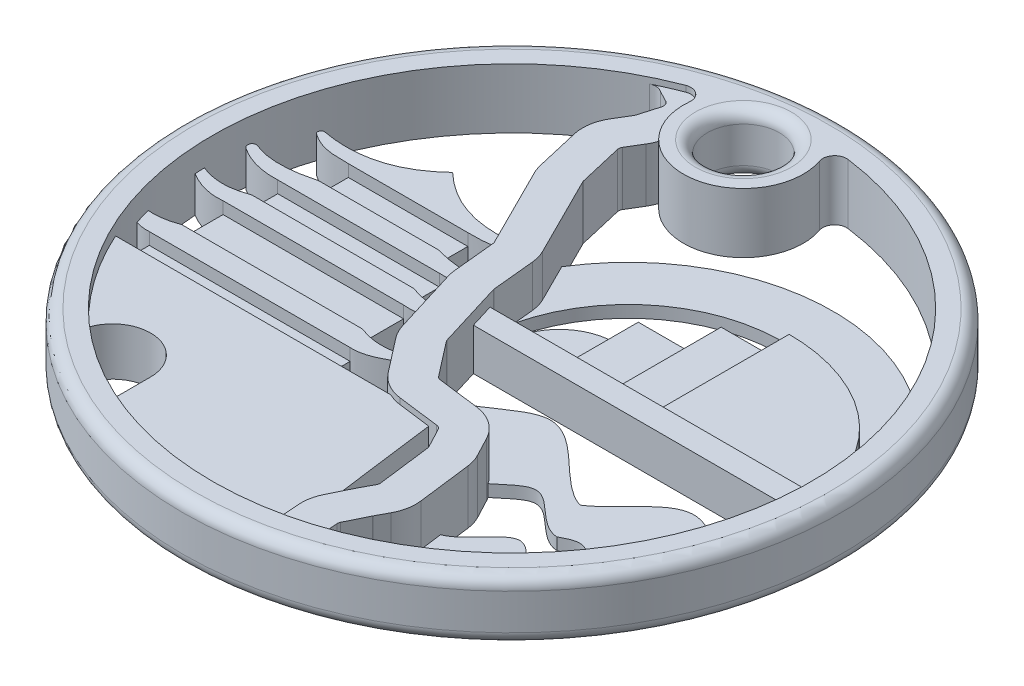
from build123d import *

# Parameters (mm, degrees)
SKETCH_2_R               = 27.5
SKETCH_2_R_2             = 25
EXTRUDE_1_DEPTH          = 5
EXTRUDE_2_DEPTH          = 4.5
SKETCH_4_R               = 0.273006505
SKETCH_4_R_2             = 0.365952535
SKETCH_4_R_3             = 0.304637926
SKETCH_4_R_4             = 0.289312323
EXTRUDE_2_2_DEPTH        = 3
SKETCH_4_3_W             = 9.97198698
SKETCH_4_3_H             = 2.474276502
SKETCH_4_3_W_2           = 13.509129154
SKETCH_4_3_H_2           = 2.168275674
SKETCH_4_3_W_3           = 15.060350668
SKETCH_4_3_H_3           = 3.449581981
SKETCH_4_3_W_4           = 16.758005346
SKETCH_4_3_H_4           = 2.720759466
EXTRUDE_3_DEPTH          = 2
EXTRUDE_4_DEPTH          = 4
EXTRUDE_5_DEPTH          = 1.5
SKETCH_8_3_W             = 4.317570968
SKETCH_8_3_H             = 1.958884726
EXTRUDE_6_DEPTH          = 2
EXTRUDE_7_DEPTH          = 2.5
EXTRUDE_8_DEPTH          = 3
SKETCH_8_6_W             = 28.985093105
SKETCH_8_6_H             = 2
EXTRUDE_9_DEPTH          = 3.5
CUT_EXTRUDE_1_DEPTH      = 49.528775397
CUT_EXTRUDE_1_DEPTH_BACK = 49.528775397
SKETCH_5_OUTSIDE_W       = 82.454
SKETCH_5_OUTSIDE_H       = 79.67
SKETCH_5_OUTSIDE_R       = 27.5
EXTRUDE_10_DEPTH         = 1
EXTRUDE_11_DEPTH         = 1
SKETCH_11_R              = 5
SKETCH_11_R_2            = 3
EXTRUDE_12_DEPTH         = 5
FILLET_1_DEPTH           = 4.5
FILLET_2_R               = 1


with BuildPart() as part:
    # 草图2 → 凸台-拉伸1 (new body)
    with BuildSketch(Plane(origin=(0, 0, 0), x_dir=(1, 0, 0), z_dir=(0, 1, 0))):
        with Locations(Location((0, 0, 0), (0, 0, 270))):
            Circle(SKETCH_2_R)
        with Locations(Location((0, 0, 0), (0, 0, 270))):
            Circle(SKETCH_2_R_2, mode=Mode.SUBTRACT)
    extrude(amount=EXTRUDE_1_DEPTH)


with BuildPart() as body_2:
    # 草图3 → Extrude 2 (new body)
    with BuildSketch(Plane(origin=(0, 0, 0), x_dir=(1, 0, 0), z_dir=(0, 1, 0))):
        with BuildLine():
            Line((80.84631891, -22.515953749), (80.683372147, -20.299877764))
            ThreePointArc((80.683372147, -20.299877764), (80.691175945, -20.167995114), (80.733248796, -20.042760103))
            Line((80.733248796, -20.042760103), (81.612869677, -18.252103309))
            ThreePointArc((81.612869677, -18.252103309), (81.617063019, -18.243764459), (81.62141129, -18.235505338))
            Line((81.62141129, -18.235505338), (82.151932536, -17.250251596))
            ThreePointArc((82.151932536, -17.250251596), (82.510986399, -16.23243541), (82.542859076, -15.153614944))
            Line((82.542859076, -15.153614944), (81.979043484, -10.676255825))
            ThreePointArc((81.979043484, -10.676255825), (81.84413837, -10.05999807), (81.600800384, -9.477967457))
            Line((81.600800384, -9.477967457), (80.755478673, -7.878710166))
            ThreePointArc((80.755478673, -7.878710166), (79.655606893, -6.638155198), (78.108211623, -6.042955705))
            Line((78.108211623, -6.042955705), (74.603802363, -5.59163027))
            ThreePointArc((74.603802363, -5.59163027), (74.419212891, -5.529626474), (74.272306972, -5.401812566))
            Line((74.272306972, -5.401812566), (72.082378064, -2.573154393))
            ThreePointArc((72.082378064, -2.573154393), (72.033823865, -2.49715156), (71.999712814, -2.413662775))
            Line((71.999712814, -2.413662775), (70.300005336, 3.128861611))
            ThreePointArc((70.300005336, 3.128861611), (70.287813759, 3.177040914), (70.280465308, 3.226192517))
            Line((70.280465308, 3.226192517), (69.930990599, 6.755887073))
            ThreePointArc((69.930990599, 6.755887073), (69.810582734, 7.382211251), (69.578515841, 7.97628615))
            Line((69.578515841, 7.97628615), (66.24020302, 14.652911792))
            ThreePointArc((66.24020302, 14.652911792), (66.217076585, 14.706871146), (66.200434151, 14.763169223))
            Line((66.200434151, 14.763169223), (65.343324773, 18.445565071))
            ThreePointArc((65.343324773, 18.445565071), (65.336476508, 18.637216483), (65.402275015, 18.817348987))
            Line((65.402275015, 18.817348987), (66.144543934, 20.046731885))
            ThreePointArc((66.144543934, 20.046731885), (66.3539779, 20.450872663), (66.509192426, 20.878775461))
            Line((66.509192426, 20.878775461), (66.990802413, 22.535513817))
            ThreePointArc((66.990802413, 22.535513817), (66.846407325, 24.892462478), (65.237908579, 26.621273838))
            Line((65.237908579, 26.621273838), (64.346739955, 27.082223126))
            Line((64.346739955, 27.082223126), (62.968471198, 24.417570197))
            Line((62.968471198, 24.417570197), (63.859639822, 23.956620909))
            ThreePointArc((63.859639822, 23.956620909), (64.089425357, 23.709647857), (64.110053227, 23.372940906))
            Line((64.110053227, 23.372940906), (63.62844324, 21.71620255))
            ThreePointArc((63.62844324, 21.71620255), (63.606269736, 21.655073579), (63.576350598, 21.597339182))
            Line((63.576350598, 21.597339182), (62.834081679, 20.367956284))
            ThreePointArc((62.834081679, 20.367956284), (62.373492129, 19.107028756), (62.421429984, 17.76546887))
            Line((62.421429984, 17.76546887), (63.278539362, 14.083073022))
            ThreePointArc((63.278539362, 14.083073022), (63.395036397, 13.688986488), (63.556921447, 13.311271005))
            Line((63.556921447, 13.311271005), (66.895234268, 6.634645364))
            ThreePointArc((66.895234268, 6.634645364), (66.928386682, 6.549777521), (66.945587805, 6.460302638))
            Line((66.945587805, 6.460302638), (67.295062514, 2.930608082))
            ThreePointArc((67.295062514, 2.930608082), (67.346501675, 2.586546862), (67.431842711, 2.249291739))
            Line((67.431842711, 2.249291739), (69.13155019, -3.293232647))
            ThreePointArc((69.13155019, -3.293232647), (69.370327548, -3.877654138), (69.710206942, -4.409673972))
            Line((69.710206942, -4.409673972), (71.90013585, -7.238332145))
            ThreePointArc((71.90013585, -7.238332145), (72.928477278, -8.133029504), (74.220603586, -8.567056071))
            Line((74.220603586, -8.567056071), (77.725012845, -9.018381506))
            ThreePointArc((77.725012845, -9.018381506), (77.946069313, -9.103410005), (78.103193853, -9.280632143))
            Line((78.103193853, -9.280632143), (78.948515563, -10.879889434))
            ThreePointArc((78.948515563, -10.879889434), (78.983278133, -10.963036664), (79.002550292, -11.051073486))
            Line((79.002550292, -11.051073486), (79.566365885, -15.528432606))
            ThreePointArc((79.566365885, -15.528432606), (79.561812645, -15.682549815), (79.510519236, -15.827952127))
            Line((79.510519236, -15.827952127), (78.979997991, -16.813205869))
            ThreePointArc((78.979997991, -16.813205869), (78.949560091, -16.871019716), (78.920206698, -16.92939167))
            Line((78.920206698, -16.92939167), (78.040585817, -18.720048464))
            ThreePointArc((78.040585817, -18.720048464), (77.74607586, -19.59669354), (77.691449271, -20.519872093))
            Line((77.691449271, -20.519872093), (77.854396034, -22.735948078))
            Line((77.854396034, -22.735948078), (80.84631891, -22.515953749))
        make_face()
    extrude(amount=EXTRUDE_2_DEPTH)


with BuildPart() as body_2_1:
    # Move Body 1: moved
    add(body_2.part.moved(Location((-72.929266944, 0, 2.062196917))))


with BuildPart() as body_3:
    # 草图4 → Extrude 2 2 (new body)
    with BuildSketch(Plane(origin=(0, 0, 0), x_dir=(1, 0, 0), z_dir=(0, 1, 0))):
        with BuildLine():
            add(Edge.make_bspline(
                [(124.772489557, 15.934871289), (123.620243616, 15.943828226), (122.542699409, 15.874404727), (121.307626428, 16.74736207)],
                knots=[0, 0, 0, 0, 1, 1, 1, 1], degree=3))
            Line((124.772489557, 15.934871289), (134.744476537, 15.934871289))
            add(Edge.make_bspline(
                [(134.744476537, 15.934871289), (135.896722477, 15.943828226), (136.974266685, 15.874404727), (138.209339666, 16.74736207)],
                knots=[0, 0, 0, 0, 1, 1, 1, 1], degree=3))
            ThreePointArc((138.209339666, 16.74736207), (137.800187268, 16.86427553), (138.002232349, 17.23877817))
            add(Edge.make_bspline(
                [(129.758483047, 19.650883252), (132.162069736, 17.347566162), (134.947477971, 16.67520049), (138.002232349, 17.23877817)],
                knots=[0, 0, 0, 0, 1, 1, 1, 1], degree=3))
            add(Edge.make_bspline(
                [(129.758483047, 19.650883252), (127.354896358, 17.347566162), (124.569488123, 16.67520049), (121.514733745, 17.23877817)],
                knots=[0, 0, 0, 0, 1, 1, 1, 1], degree=3))
            ThreePointArc((121.514733745, 17.23877817), (121.675029453, 17.144959477), (121.738208647, 16.970302525))
            ThreePointArc((121.738208647, 16.970302525), (121.59072775, 16.727865165), (121.307626428, 16.74736207))
        make_face()
        with Locations((138.051763952, 16.970302525)):
            Circle(SKETCH_4_R)
        with Locations((121.465202142, 16.970302525)):
            Circle(SKETCH_4_R)
        with BuildLine():
            add(Edge.make_bspline(
                [(123.00391847, 11.812882774), (121.778732438, 11.748986371), (120.498656355, 12.026105509), (119.359005649, 12.79713933)],
                knots=[0, 0, 0, 0, 0.977036125, 0.977036125, 0.977036125, 0.977036125], degree=3))
            Line((123.00391847, 11.812882774), (136.513047624, 11.812882774))
            add(Edge.make_bspline(
                [(136.513047624, 11.812882774), (137.738233649, 11.748986372), (139.018309724, 12.026105506), (140.157960426, 12.797139318)],
                knots=[0, 0, 0, 0, 0.97703612, 0.97703612, 0.97703612, 0.97703612], degree=3))
            ThreePointArc((140.157960426, 12.797139318), (139.630560577, 12.926975479), (139.813217932, 13.438487277))
            add(Edge.make_bspline(
                [(134.744476537, 13.460594787), (136.283733959, 13.053749914), (138.159729546, 12.755680682), (139.813217932, 13.438487277)],
                knots=[0, 0, 0, 0, 0.943649517, 0.943649517, 0.943649517, 0.943649517], degree=3))
            Line((134.744476537, 13.460594787), (124.772489557, 13.460594787))
            add(Edge.make_bspline(
                [(124.772489557, 13.460594787), (123.233232169, 13.053749923), (121.357236633, 12.755680695), (119.703748274, 13.438487231)],
                knots=[0, 0, 0, 0, 0.943649496, 0.943649496, 0.943649496, 0.943649496], degree=3))
            ThreePointArc((119.703748274, 13.438487231), (119.86823799, 13.303716733), (119.930021896, 13.100240192))
            ThreePointArc((119.930021896, 13.100240192), (119.735646855, 12.777002784), (119.359005649, 12.79713933))
        make_face()
        with Locations((139.952896733, 13.100240192)):
            Circle(SKETCH_4_R_2)
        with Locations((119.564069361, 13.100240192)):
            Circle(SKETCH_4_R_2)
        with Locations((118.748333605, 9.43537965)):
            Circle(SKETCH_4_R_3)
        with BuildLine():
            add(Edge.make_bspline(
                [(122.228307713, 8.024059498), (120.978920852, 7.89660154), (119.755873035, 8.292859353), (118.56475886, 9.192265317)],
                knots=[0, 0, 0, 0, 1, 1, 1, 1], degree=3))
            Line((122.228307713, 8.024059498), (137.288658381, 8.024059498))
            add(Edge.make_bspline(
                [(137.288658381, 8.024059498), (138.538045242, 7.89660154), (139.761093059, 8.292859353), (140.952207234, 9.192265317)],
                knots=[0, 0, 0, 0, 1, 1, 1, 1], degree=3))
            ThreePointArc((140.952207234, 9.192265317), (140.507123298, 9.279119582), (140.641513072, 9.712227839))
            add(Edge.make_bspline(
                [(136.513047624, 9.6446071), (137.834000651, 9.145713653), (139.182668915, 9.042375247), (140.641513072, 9.712227839)],
                knots=[0, 0, 0, 0, 0.952505861, 0.952505861, 0.952505861, 0.952505861], degree=3))
            Line((136.513047624, 9.6446071), (123.00391847, 9.6446071))
            add(Edge.make_bspline(
                [(123.00391847, 9.6446071), (121.682965472, 9.145713663), (120.334297238, 9.042375251), (118.875453117, 9.712227795)],
                knots=[0, 0, 0, 0, 0.95250584, 0.95250584, 0.95250584, 0.95250584], degree=3))
            ThreePointArc((118.875453117, 9.712227795), (119.004780178, 9.599816327), (119.05297153, 9.43537965))
            ThreePointArc((119.05297153, 9.43537965), (118.884128369, 9.162681928), (118.56475886, 9.192265317))
        make_face()
        with Locations((140.768632489, 9.43537965)):
            Circle(SKETCH_4_R_3)
        with Locations((118.0110393, 4.344585313)):
            Circle(SKETCH_4_R_4)
        with BuildLine():
            add(Edge.make_bspline(
                [(121.379480374, 2.720759466), (120.022297972, 2.626602796), (118.680670989, 3.544583902), (117.849385787, 4.104648317)],
                knots=[0, 0, 0, 0, 1, 1, 1, 1], degree=3))
            Line((121.379480374, 2.720759466), (138.13748572, 2.720759466))
            add(Edge.make_bspline(
                [(138.13748572, 2.720759466), (139.494668122, 2.626602796), (140.836295105, 3.544583902), (141.667580307, 4.104648317)],
                knots=[0, 0, 0, 0, 1, 1, 1, 1], degree=3))
            ThreePointArc((141.667580307, 4.104648317), (141.249139627, 4.211311266), (141.402766688, 4.614880731))
            add(Edge.make_bspline(
                [(137.288658381, 4.574477517), (138.802605745, 3.995611742), (140.049000445, 4.098207098), (141.402766688, 4.614880731)],
                knots=[0, 0, 0, 0, 0.937457542, 0.937457542, 0.937457542, 0.937457542], degree=3))
            Line((137.288658381, 4.574477517), (122.228307713, 4.574477517))
            add(Edge.make_bspline(
                [(122.228307713, 4.574477517), (120.714360321, 3.995611731), (119.467965602, 4.098207102), (118.114199331, 4.61488076)],
                knots=[0, 0, 0, 0, 0.937457559, 0.937457559, 0.937457559, 0.937457559], degree=3))
            ThreePointArc((118.114199331, 4.61488076), (118.249311297, 4.508683077), (118.300351624, 4.344585313))
            ThreePointArc((118.300351624, 4.344585313), (118.146931292, 4.089173906), (117.849385787, 4.104648317))
        make_face()
        with Locations((141.505926793, 4.344585313)):
            Circle(SKETCH_4_R_4)
    extrude(amount=EXTRUDE_2_2_DEPTH)

    # 草图4<3> → 凸台-拉伸3 (add)
    with BuildSketch(Plane(origin=(0, 0, 0), x_dir=(1, 0, 0), z_dir=(0, 1, 0))):
        with Locations((129.758483047, 14.697733038)):
            Rectangle(SKETCH_4_3_W, SKETCH_4_3_H)
        with Locations((129.758483047, 10.728744937)):
            Rectangle(SKETCH_4_3_W_2, SKETCH_4_3_H_2)
        with Locations((129.758483047, 6.299268507)):
            Rectangle(SKETCH_4_3_W_3, SKETCH_4_3_H_3)
        with Locations((129.758483047, 1.360379733)):
            Rectangle(SKETCH_4_3_W_4, SKETCH_4_3_H_4)
    extrude(amount=EXTRUDE_3_DEPTH)

    # 草图4<4> → 凸台-拉伸4 (add)
    with BuildSketch(Plane(origin=(0, 0, 0), x_dir=(1, 0, 0), z_dir=(0, 1, 0))):
        with BuildLine():
            Line((111.508613967, 0), (109.886296251, -12.363046795))
            Line((109.886296251, -12.363046795), (116.957815682, -12.363046795))
            Line((116.957815682, -12.363046795), (119.058775833, -12.363046795))
            Line((119.058775833, -12.363046795), (126.575811458, -12.363046795))
            Line((126.575811458, -12.363046795), (126.575811458, -8.735760096))
            ThreePointArc((126.575811458, -8.735760096), (129.758483047, -5.553088507), (132.941154636, -8.735760096))
            Line((132.941154636, -8.735760096), (132.941154636, -12.363046795))
            Line((132.941154636, -12.363046795), (140.458190261, -12.363046795))
            Line((140.458190261, -12.363046795), (142.559150412, -12.363046795))
            Line((142.559150412, -12.363046795), (149.630669843, -12.363046795))
            Line((149.630669843, -12.363046795), (148.008352127, 0))
            Line((148.008352127, 0), (138.13748572, 0))
            Line((138.13748572, 0), (121.379480374, 0))
            Line((121.379480374, 0), (111.508613967, 0))
        make_face()
        Polygon((149.630669843, -12.363046795), (150.949282601, -22.411677268), (108.567683493, -22.411677268), (109.886296251, -12.363046795), align=None)
    extrude(amount=EXTRUDE_4_DEPTH)


with BuildPart() as body_3_1:
    # Move Body 2: moved
    add(body_3.part.moved(Location((-144.06370891, 0, 10.300311474))))

    # 草图5 outside → 切除-拉伸1 (cut, two sides: drawn at the far end of the back side and taken through both)
    with BuildSketch(Plane(origin=(0, 0, 0), x_dir=(1, 0, 0), z_dir=(0, 1, 0)).offset(-CUT_EXTRUDE_1_DEPTH_BACK)):
        with Locations((-3.998, -2.606)):
            Rectangle(SKETCH_5_OUTSIDE_W, SKETCH_5_OUTSIDE_H)
        with Locations(Location((0, 0, 0), (0, 0, 270))):
            Circle(SKETCH_5_OUTSIDE_R, mode=Mode.SUBTRACT)
    extrude(amount=CUT_EXTRUDE_1_DEPTH + CUT_EXTRUDE_1_DEPTH_BACK, mode=Mode.SUBTRACT)


with BuildPart() as body_4:
    # 草图8 → 凸台-拉伸5 (new body)
    with BuildSketch(Plane(origin=(0, 0, 0), x_dir=(1, 0, 0), z_dir=(0, 1, 0))):
        with BuildLine():
            Line((-1.376359802, 0.677275538), (3.262729384, 0.677275538))
            Line((3.262729384, 0.677275538), (3.262729384, 5.316364724))
            ThreePointArc((3.262729384, 5.316364724), (-0.017602037, 3.95760696), (-1.376359802, 0.677275539))
        make_face()
    extrude(amount=EXTRUDE_5_DEPTH)

    # 草图8<3> → 凸台-拉伸6 (add)
    with BuildSketch(Plane(origin=(0, 0, 0), x_dir=(1, 0, 0), z_dir=(0, 1, 0))):
        with BuildLine():
            Line((7.580300352, 5.316364724), (3.262729384, 5.316364724))
            ThreePointArc((3.262729384, 5.316364724), (5.875077266, 4.510914412), (7.580300352, 2.374252087))
            Line((7.580300352, 2.374252087), (7.580300352, 5.316364724))
        make_face()
        with BuildLine():
            Line((3.262729384, 5.316364724), (3.262729384, 0.677275538))
            Line((3.262729384, 0.677275538), (7.580300352, 0.677275538))
            Line((7.580300352, 0.677275538), (7.580300352, 2.374252087))
            ThreePointArc((7.580300352, 2.374252087), (5.875077266, 4.510914412), (3.262729384, 5.316364724))
        make_face()
        with Locations((5.421514868, 6.295807087)):
            Rectangle(SKETCH_8_3_W, SKETCH_8_3_H)
    extrude(amount=EXTRUDE_6_DEPTH)

    # 草图8<4> → 凸台-拉伸7 (add)
    with BuildSketch(Plane(origin=(0, 0, 0), x_dir=(1, 0, 0), z_dir=(0, 1, 0))):
        with BuildLine():
            ThreePointArc((7.580300352, 2.374252087), (7.820730331, 1.54085868), (7.901818569, 0.677275538))
            Line((7.901818569, 0.677275538), (11.435904312, 0.677275538))
            Line((11.435904312, 0.677275538), (11.435904312, 9.871292542))
            Line((11.435904312, 9.871292542), (7.580300352, 9.871292542))
            Line((7.580300352, 9.871292542), (7.580300352, 7.27524945))
            Line((7.580300352, 7.27524945), (7.580300352, 5.316364724))
            Line((7.580300352, 5.316364724), (7.580300352, 2.374252087))
        make_face()
        with BuildLine():
            Line((7.580300352, 2.374252087), (7.580300352, 0.677275538))
            Line((7.580300352, 0.677275538), (7.901818569, 0.677275538))
            ThreePointArc((7.901818569, 0.677275538), (7.820730331, 1.54085868), (7.580300352, 2.374252087))
        make_face()
    extrude(amount=EXTRUDE_7_DEPTH)

    # 草图8<5> → 凸台-拉伸8 (add)
    with BuildSketch(Plane(origin=(0, 0, 0), x_dir=(1, 0, 0), z_dir=(0, 1, 0))):
        with BuildLine():
            add(Edge.make_bspline(
                [(24.248168426, 0.677275538), (24.248168426, 11.689904798), (11.435904312, 11.689904798)],
                knots=[0, 0, 0, 1.570796327, 1.570796327, 1.570796327], degree=2, weights=[1, 0.707106781, 1]))
            Line((11.435904312, 11.689904798), (11.435904312, 9.871292542))
            Line((11.435904312, 9.871292542), (11.435904312, 0.677275538))
            Line((11.435904312, 0.677275538), (24.248168426, 0.677275538))
        make_face()
    extrude(amount=EXTRUDE_8_DEPTH)

    # 草图8<6> → 凸台-拉伸9 (add)
    with BuildSketch(Plane(origin=(0, 0, 0), x_dir=(1, 0, 0), z_dir=(0, 1, 0))):
        with Locations((11.59537876, -0.322724462)):
            Rectangle(SKETCH_8_6_W, SKETCH_8_6_H)
    extrude(amount=EXTRUDE_9_DEPTH)


with BuildPart() as part_1:
    add(part.part)

    # Combine 1: union body 2, body 3, body 4
    add(body_2_1.part)
    add(body_3_1.part)
    add(body_4.part)

    # 草图9 → 凸台-拉伸10 (add)
    with BuildSketch(Plane(origin=(0, 0, 0), x_dir=(1, 0, 0), z_dir=(0, 1, 0))):
        with BuildLine():
            add(Edge.make_bspline(
                [(-1.782830539, -5.365319868), (1.01911732, -6.103250257), (5.895011208, 1.455271766), (10.664736889, -6.689367874), (13.065662352, -7.36991822)],
                knots=[0, 0, 0, 0, 0.475392712, 1, 1, 1, 1], degree=3))
            Line((-1.782830539, -5.365319868), (3.953440254, -9.984037433))
            Line((3.953440254, -9.984037433), (5.730511703, -10.501067084))
            add(Edge.make_bspline(
                [(5.730511703, -10.501067084), (7.440686991, -10.570279918), (10.138431709, -5.687296392), (12.721815522, -10.527992117), (14.378036336, -10.636076527)],
                knots=[0, 0, 0, 0, 0.504062323, 1, 1, 1, 1], degree=3))
            add(Edge.make_bspline(
                [(14.378036336, -10.636076527), (14.858861128, -10.386065525), (16.281271173, -9.609026412), (17.615036124, -11.2773733), (18.510967726, -11.645127153)],
                knots=[0.278403146, 0.278403146, 0.278403146, 0.278403146, 0.515536839, 1, 1, 1, 1], degree=3))
            add(Edge.make_bspline(
                [(18.510967726, -11.645127153), (19.44313118, -11.202773105), (21.382270083, -10.32937152), (23.028327131, -12.25377296), (24.010357425, -12.651369912)],
                knots=[0.34128537, 0.34128537, 0.34128537, 0.34128537, 0.648717257, 1, 1, 1, 1], degree=3))
            Line((24.010357425, -12.651369912), (25.195486487, -7.143398681))
            add(Edge.make_bspline(
                [(13.065662352, -7.36991822), (14.6612193, -6.377796673), (18.333188359, -0.328015312), (22.9028242, -6.249149078), (25.195486487, -7.143398681)],
                knots=[0, 0, 0, 0, 0.445141704, 1, 1, 1, 1], degree=3))
        make_face()
        with BuildLine():
            add(Edge.make_bspline(
                [(8.411751513, -15.421817529), (10.43495973, -15.8216733), (12.830570949, -9.431889246), (15.666033568, -15.125742623), (16.778330562, -15.693319438)],
                knots=[0, 0, 0, 0, 0.539502855, 1, 1, 1, 1], degree=3))
            Line((8.411751513, -15.421817529), (7.731448853, -21.444865665))
            add(Edge.make_bspline(
                [(7.731448853, -21.444865665), (9.807864503, -21.121521021), (13.474568416, -16.232936813), (15.968940306, -20.691626838), (17.332096372, -20.925786356)],
                knots=[0, 0, 0, 0, 0.621686257, 1, 1, 1, 1], degree=3))
            Line((17.332096372, -20.925786356), (21.084007572, -16.489743157))
            add(Edge.make_bspline(
                [(16.778330562, -15.693319438), (17.467635768, -15.356313393), (19.064329177, -14.004872363), (20.326174066, -16.201043013), (21.084007572, -16.489743157)],
                knots=[0.183213293, 0.183213293, 0.183213293, 0.183213293, 0.534551223, 1, 1, 1, 1], degree=3))
        make_face()
    extrude(amount=EXTRUDE_10_DEPTH)

    # 草图10 → 凸台-拉伸11 (add)
    with BuildSketch(Plane(origin=(0, 0, 0), x_dir=(1, 0, 0), z_dir=(0, 1, 0))):
        with BuildLine():
            ThreePointArc((26.673228047, 0.119101347), (12.897774421, 16.873396567), (-6.203358904, 6.596420522))
            Line((-6.203358904, 6.596420522), (-3.115832762, 1.284539982))
            ThreePointArc((-3.115832762, 1.284539982), (10.180185031, 12.871765428), (22.362854752, 0.119101347))
            ThreePointArc((22.362854752, 0.119101347), (22.361683923, -0.053792323), (22.358171652, -0.226654279))
            Line((22.358171652, -0.226654279), (26.673228047, 0.119101347))
        make_face()
    extrude(amount=EXTRUDE_11_DEPTH)

    # 草图11 → 凸台-拉伸12 (add)
    with BuildSketch(Plane(origin=(0, 0, 0), x_dir=(1, 0, 0), z_dir=(0, 1, 0))):
        with Locations((-2.545144991, 21.852282191)):
            Circle(SKETCH_11_R)
        with Locations(Location((-2.545144991, 21.852282191, 0), (0, 0, 270))):
            Circle(SKETCH_11_R_2, mode=Mode.SUBTRACT)
    extrude(amount=EXTRUDE_12_DEPTH)

    # 圆角1: read off the stored shape, not the designer's step
    # 圆角1 outline → 圆角1 (add)
    with BuildSketch(Plane(origin=(0, 0, 0), x_dir=(1, 0, 0), z_dir=(0, 1, 0))):
        with BuildLine():
            ThreePointArc((-9.579962817, 23.091650276), (-10.293772231, 22.782411051), (-10.997614757, 22.451112883))
            ThreePointArc((-10.997614757, 22.451112883), (-10.465761596, 22.548832124), (-9.960795745, 22.35537328))
            Line((-9.960795745, 22.35537328), (-9.579962817, 23.091650276))
        make_face()
    extrude(amount=FILLET_1_DEPTH)

    # 圆角2
    fillet_2_edges = [part_1.edges().sort_by_distance(p)[0] for p in [
        (0, 0, -27.5),
        (1.369812628, 2.5, -24.962444058),
        (-7.070096038, 4.75, -23.979444156),
        (-2.545144991, 0, -24.852282191),
        (-2.545144991, 5, -24.852282191),
        (0, 5, -27.5),
    ]]
    fillet(fillet_2_edges, radius=FILLET_2_R)


solid = part_1.part
